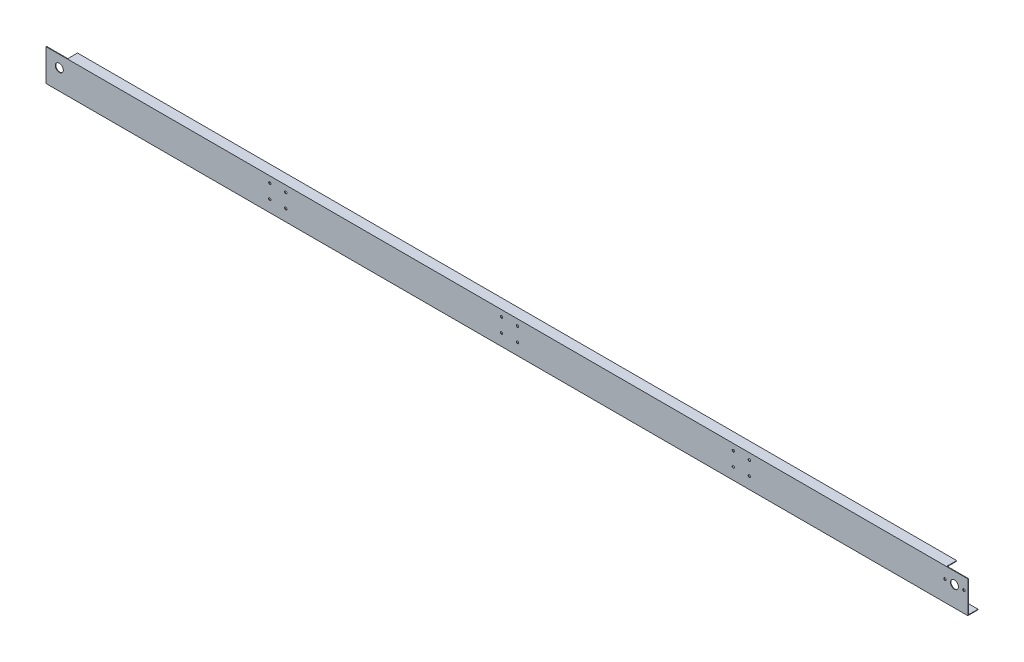
from build123d import *

# Parameters (mm, degrees)
BOSS_EXTRUDE1_DEPTH = 4394.2
CUT_EXTRUDE1_REACH  = 4398.278
SKETCH2_R           = 19.05
SKETCH2_R_2         = 5.55625
CUT_EXTRUDE4_REACH  = 4398.278
SKETCH3_W           = 101.6
SKETCH3_H           = 2.54
CUT_EXTRUDE5_REACH  = 4398.278
SKETCH4_R           = 5.55625


with BuildPart() as part:
    # Sketch1 → Boss-Extrude1 (new body)
    with BuildSketch(Plane(origin=(0, 0, 0), x_dir=(0, 0, -1), z_dir=(1, 0, 0))):
        Polygon((0, 0), (0, 127), (48.768, 127), (48.768, 124.46), (2.54, 124.46), (2.54, 1.614582281), (2.54, -22.86), (48.768, -22.86), (48.768, -25.4), (0, -25.4), align=None)
    extrude(amount=BOSS_EXTRUDE1_DEPTH)

    # Sketch2 → Cut-Extrude1 (cut, up to next)
    with BuildSketch(Plane(origin=(0, 0, -2.54), x_dir=(-1, 0, 0), z_dir=(0, 0, -1)), mode=Mode.PRIVATE) as cut_extrude1_sk1:
        with Locations((-4330.7, 71.12)):
            Circle(SKETCH2_R)
    cut_extrude1_tool1 = extrude(cut_extrude1_sk1.sketch, amount=-CUT_EXTRUDE1_REACH, mode=Mode.PRIVATE) & part.part
    # Sketch2 → Cut-Extrude1 (cut, up to next)
    with BuildSketch(Plane(origin=(0, 0, -2.54), x_dir=(-1, 0, 0), z_dir=(0, 0, -1)), mode=Mode.PRIVATE) as cut_extrude1_sk2:
        with Locations((-63.5, 71.12)):
            Circle(SKETCH2_R)
    cut_extrude1_tool2 = extrude(cut_extrude1_sk2.sketch, amount=-CUT_EXTRUDE1_REACH, mode=Mode.PRIVATE) & part.part
    # Sketch2 → Cut-Extrude1 (cut, up to next)
    with BuildSketch(Plane(origin=(0, 0, -2.54), x_dir=(-1, 0, 0), z_dir=(0, 0, -1)), mode=Mode.PRIVATE) as cut_extrude1_sk3:
        with Locations((-4285.6546875, 71.12)):
            Circle(SKETCH2_R_2)
    cut_extrude1_tool3 = extrude(cut_extrude1_sk3.sketch, amount=-CUT_EXTRUDE1_REACH, mode=Mode.PRIVATE) & part.part
    # Sketch2 → Cut-Extrude1 (cut, up to next)
    with BuildSketch(Plane(origin=(0, 0, -2.54), x_dir=(-1, 0, 0), z_dir=(0, 0, -1)), mode=Mode.PRIVATE) as cut_extrude1_sk4:
        with Locations((-4375.7453125, 71.12)):
            Circle(SKETCH2_R_2)
    cut_extrude1_tool4 = extrude(cut_extrude1_sk4.sketch, amount=-CUT_EXTRUDE1_REACH, mode=Mode.PRIVATE) & part.part
    add(cut_extrude1_tool1.solids().sort_by_distance((4330.7, 71.12, -2.54))[0], mode=Mode.SUBTRACT)
    add(cut_extrude1_tool2.solids().sort_by_distance((63.5, 71.12, -2.54))[0], mode=Mode.SUBTRACT)
    add(cut_extrude1_tool3.solids().sort_by_distance((4285.654687, 71.12, -2.54))[0], mode=Mode.SUBTRACT)
    add(cut_extrude1_tool4.solids().sort_by_distance((4375.745312, 71.12, -2.54))[0], mode=Mode.SUBTRACT)

    # Sketch3 → Cut-Extrude4 (cut, up to next)
    with BuildSketch(Plane(origin=(0, 0, -2.54), x_dir=(-1, 0, 0), z_dir=(0, 0, -1)), mode=Mode.PRIVATE) as cut_extrude4_sk1:
        with Locations((-4343.4, 125.73)):
            Rectangle(SKETCH3_W, SKETCH3_H)
    cut_extrude4_tool1 = extrude(cut_extrude4_sk1.sketch, amount=CUT_EXTRUDE4_REACH, mode=Mode.PRIVATE) & part.part
    # Sketch3 → Cut-Extrude4 (cut, up to next)
    with BuildSketch(Plane(origin=(0, 0, -2.54), x_dir=(-1, 0, 0), z_dir=(0, 0, -1)), mode=Mode.PRIVATE) as cut_extrude4_sk2:
        with Locations((-50.8, 125.73)):
            Rectangle(SKETCH3_W, SKETCH3_H)
    cut_extrude4_tool2 = extrude(cut_extrude4_sk2.sketch, amount=CUT_EXTRUDE4_REACH, mode=Mode.PRIVATE) & part.part
    add(cut_extrude4_tool1.solids().sort_by_distance((4343.4, 125.73, -2.54))[0], mode=Mode.SUBTRACT)
    add(cut_extrude4_tool2.solids().sort_by_distance((50.8, 125.73, -2.54))[0], mode=Mode.SUBTRACT)

    # Sketch4 → Cut-Extrude5 (cut, up to next)
    with BuildSketch(Plane(origin=(0, 0, -2.54), x_dir=(-1, 0, 0), z_dir=(0, 0, -1)), mode=Mode.PRIVATE) as cut_extrude5_sk1:
        with Locations((-1066.8, 96.774)):
            Circle(SKETCH4_R)
    cut_extrude5_tool1 = extrude(cut_extrude5_sk1.sketch, amount=-CUT_EXTRUDE5_REACH, mode=Mode.PRIVATE) & part.part
    # Sketch4 → Cut-Extrude5 (cut, up to next)
    with BuildSketch(Plane(origin=(0, 0, -2.54), x_dir=(-1, 0, 0), z_dir=(0, 0, -1)), mode=Mode.PRIVATE) as cut_extrude5_sk2:
        with Locations((-1066.8, 30.226)):
            Circle(SKETCH4_R)
    cut_extrude5_tool2 = extrude(cut_extrude5_sk2.sketch, amount=-CUT_EXTRUDE5_REACH, mode=Mode.PRIVATE) & part.part
    # Sketch4 → Cut-Extrude5 (cut, up to next)
    with BuildSketch(Plane(origin=(0, 0, -2.54), x_dir=(-1, 0, 0), z_dir=(0, 0, -1)), mode=Mode.PRIVATE) as cut_extrude5_sk3:
        with Locations((-1143, 30.226)):
            Circle(SKETCH4_R)
    cut_extrude5_tool3 = extrude(cut_extrude5_sk3.sketch, amount=-CUT_EXTRUDE5_REACH, mode=Mode.PRIVATE) & part.part
    # Sketch4 → Cut-Extrude5 (cut, up to next)
    with BuildSketch(Plane(origin=(0, 0, -2.54), x_dir=(-1, 0, 0), z_dir=(0, 0, -1)), mode=Mode.PRIVATE) as cut_extrude5_sk4:
        with Locations((-1143, 96.774)):
            Circle(SKETCH4_R)
    cut_extrude5_tool4 = extrude(cut_extrude5_sk4.sketch, amount=-CUT_EXTRUDE5_REACH, mode=Mode.PRIVATE) & part.part
    # Sketch4 → Cut-Extrude5 (cut, up to next)
    with BuildSketch(Plane(origin=(0, 0, -2.54), x_dir=(-1, 0, 0), z_dir=(0, 0, -1)), mode=Mode.PRIVATE) as cut_extrude5_sk5:
        with Locations((-2171.7, 96.774)):
            Circle(SKETCH4_R)
    cut_extrude5_tool5 = extrude(cut_extrude5_sk5.sketch, amount=-CUT_EXTRUDE5_REACH, mode=Mode.PRIVATE) & part.part
    # Sketch4 → Cut-Extrude5 (cut, up to next)
    with BuildSketch(Plane(origin=(0, 0, -2.54), x_dir=(-1, 0, 0), z_dir=(0, 0, -1)), mode=Mode.PRIVATE) as cut_extrude5_sk6:
        with Locations((-2171.7, 30.226)):
            Circle(SKETCH4_R)
    cut_extrude5_tool6 = extrude(cut_extrude5_sk6.sketch, amount=-CUT_EXTRUDE5_REACH, mode=Mode.PRIVATE) & part.part
    # Sketch4 → Cut-Extrude5 (cut, up to next)
    with BuildSketch(Plane(origin=(0, 0, -2.54), x_dir=(-1, 0, 0), z_dir=(0, 0, -1)), mode=Mode.PRIVATE) as cut_extrude5_sk7:
        with Locations((-2247.9, 30.226)):
            Circle(SKETCH4_R)
    cut_extrude5_tool7 = extrude(cut_extrude5_sk7.sketch, amount=-CUT_EXTRUDE5_REACH, mode=Mode.PRIVATE) & part.part
    # Sketch4 → Cut-Extrude5 (cut, up to next)
    with BuildSketch(Plane(origin=(0, 0, -2.54), x_dir=(-1, 0, 0), z_dir=(0, 0, -1)), mode=Mode.PRIVATE) as cut_extrude5_sk8:
        with Locations((-2247.9, 96.774)):
            Circle(SKETCH4_R)
    cut_extrude5_tool8 = extrude(cut_extrude5_sk8.sketch, amount=-CUT_EXTRUDE5_REACH, mode=Mode.PRIVATE) & part.part
    # Sketch4 → Cut-Extrude5 (cut, up to next)
    with BuildSketch(Plane(origin=(0, 0, -2.54), x_dir=(-1, 0, 0), z_dir=(0, 0, -1)), mode=Mode.PRIVATE) as cut_extrude5_sk9:
        with Locations((-3276.6, 96.774)):
            Circle(SKETCH4_R)
    cut_extrude5_tool9 = extrude(cut_extrude5_sk9.sketch, amount=-CUT_EXTRUDE5_REACH, mode=Mode.PRIVATE) & part.part
    # Sketch4 → Cut-Extrude5 (cut, up to next)
    with BuildSketch(Plane(origin=(0, 0, -2.54), x_dir=(-1, 0, 0), z_dir=(0, 0, -1)), mode=Mode.PRIVATE) as cut_extrude5_sk10:
        with Locations((-3276.6, 30.226)):
            Circle(SKETCH4_R)
    cut_extrude5_tool10 = extrude(cut_extrude5_sk10.sketch, amount=-CUT_EXTRUDE5_REACH, mode=Mode.PRIVATE) & part.part
    # Sketch4 → Cut-Extrude5 (cut, up to next)
    with BuildSketch(Plane(origin=(0, 0, -2.54), x_dir=(-1, 0, 0), z_dir=(0, 0, -1)), mode=Mode.PRIVATE) as cut_extrude5_sk11:
        with Locations((-3352.8, 30.226)):
            Circle(SKETCH4_R)
    cut_extrude5_tool11 = extrude(cut_extrude5_sk11.sketch, amount=-CUT_EXTRUDE5_REACH, mode=Mode.PRIVATE) & part.part
    # Sketch4 → Cut-Extrude5 (cut, up to next)
    with BuildSketch(Plane(origin=(0, 0, -2.54), x_dir=(-1, 0, 0), z_dir=(0, 0, -1)), mode=Mode.PRIVATE) as cut_extrude5_sk12:
        with Locations((-3352.8, 96.774)):
            Circle(SKETCH4_R)
    cut_extrude5_tool12 = extrude(cut_extrude5_sk12.sketch, amount=-CUT_EXTRUDE5_REACH, mode=Mode.PRIVATE) & part.part
    add(cut_extrude5_tool1.solids().sort_by_distance((1066.8, 96.774, -2.54))[0], mode=Mode.SUBTRACT)
    add(cut_extrude5_tool2.solids().sort_by_distance((1066.8, 30.226, -2.54))[0], mode=Mode.SUBTRACT)
    add(cut_extrude5_tool3.solids().sort_by_distance((1143, 30.226, -2.54))[0], mode=Mode.SUBTRACT)
    add(cut_extrude5_tool4.solids().sort_by_distance((1143, 96.774, -2.54))[0], mode=Mode.SUBTRACT)
    add(cut_extrude5_tool5.solids().sort_by_distance((2171.7, 96.774, -2.54))[0], mode=Mode.SUBTRACT)
    add(cut_extrude5_tool6.solids().sort_by_distance((2171.7, 30.226, -2.54))[0], mode=Mode.SUBTRACT)
    add(cut_extrude5_tool7.solids().sort_by_distance((2247.9, 30.226, -2.54))[0], mode=Mode.SUBTRACT)
    add(cut_extrude5_tool8.solids().sort_by_distance((2247.9, 96.774, -2.54))[0], mode=Mode.SUBTRACT)
    add(cut_extrude5_tool9.solids().sort_by_distance((3276.6, 96.774, -2.54))[0], mode=Mode.SUBTRACT)
    add(cut_extrude5_tool10.solids().sort_by_distance((3276.6, 30.226, -2.54))[0], mode=Mode.SUBTRACT)
    add(cut_extrude5_tool11.solids().sort_by_distance((3352.8, 30.226, -2.54))[0], mode=Mode.SUBTRACT)
    add(cut_extrude5_tool12.solids().sort_by_distance((3352.8, 96.774, -2.54))[0], mode=Mode.SUBTRACT)


solid = part.part
